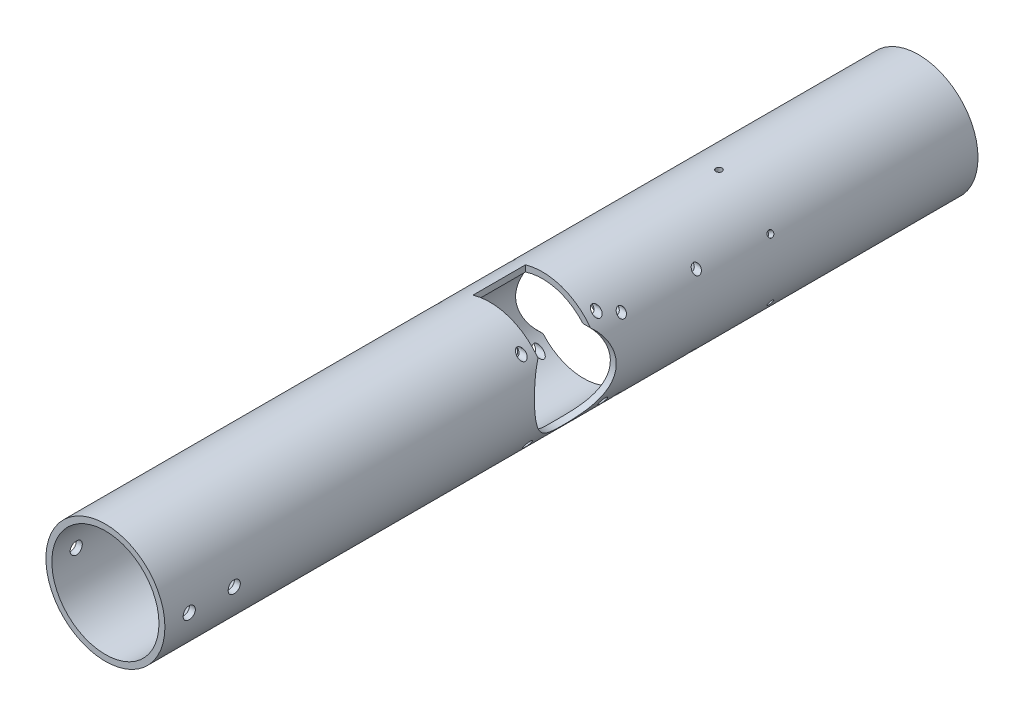
from build123d import *

# Parameters (mm, degrees)
BOSS_EXTRUDE1_DEPTH           = 125
BOSS_EXTRUDE1_DEPTH_BACK      = 250
SKETCH1_R                     = 31.75
SKETCH1_R_2                   = 28.575
SKETCH2_R                     = 21.75
CUT_EXTRUDE1_DEPTH            = 255.000246063
SKETCH3_R                     = 21.75
CUT_EXTRUDE2_DEPTH            = 255.000246187
CUT_EXTRUDE4_START            = 9
SKETCH5_W                     = 28
SKETCH5_H                     = 22
CUT_EXTRUDE4_DEPTH            = 264.000246187
CUT_EXTRUDE5_START            = -9
SKETCH6_W                     = 28
SKETCH6_H                     = 22
CUT_EXTRUDE5_DEPTH            = 264.000246187
CUT_EXTRUDE8_DEPTH            = 255.000246187
CUT_EXTRUDE8_DEPTH_BACK       = 255.000246187
SKETCH11_R                    = 2
CUT_EXTRUDE10_DEPTH           = 255.000246187
CUT_EXTRUDE10_DEPTH_BACK      = 255.000246187
SKETCH12_R                    = 3.25
CUT_EXTRUDE12_DEPTH           = 255.000246187
CUT_EXTRUDE12_DEPTH_BACK      = 255.000246187
SKETCH15_R                    = 2
SKETCH19_W                    = 2.25
SKETCH19_H                    = 31.75
M4_CLEARANCE_HOLE1_AT_2_COUNT = 2
M4_CLEARANCE_HOLE1_AT_2_PITCH = 40
M4_CLEARANCE_HOLE1_AT_3_COUNT = 2
M4_CLEARANCE_HOLE1_AT_3_PITCH = 40
M4_CLEARANCE_HOLE1_AT_4_COUNT = 2
M4_CLEARANCE_HOLE1_AT_4_PITCH = 56.568542495
M4_CLEARANCE_HOLE1_AT_5_COUNT = 2
M4_CLEARANCE_HOLE1_AT_5_PITCH = 90.126807577
M4_CLEARANCE_HOLE1_AT_6_COUNT = 2
M4_CLEARANCE_HOLE1_AT_6_PITCH = 50.197623888
M4_CLEARANCE_HOLE1_AT_7_COUNT = 2
M4_CLEARANCE_HOLE1_AT_7_PITCH = 100.213978286
M4_CLEARANCE_HOLE1_AT_8_COUNT = 2
M4_CLEARANCE_HOLE1_AT_8_PITCH = 66.631835064
MIRROR1_COPY_1_SKETCH_W       = 2.25
MIRROR1_COPY_1_SKETCH_H       = 31.75
MIRROR1_COPY_2_SKETCH_W       = 2.25
MIRROR1_COPY_2_SKETCH_H       = 31.75
MIRROR1_COPY_3_SKETCH_W       = 2.25
MIRROR1_COPY_3_SKETCH_H       = 31.75
MIRROR1_COPY_4_SKETCH_W       = 2.25
MIRROR1_COPY_4_SKETCH_H       = 31.75
MIRROR1_COPY_5_SKETCH_W       = 2.25
MIRROR1_COPY_5_SKETCH_H       = 31.75
MIRROR1_COPY_6_SKETCH_W       = 2.25
MIRROR1_COPY_6_SKETCH_H       = 31.75
MIRROR1_COPY_7_SKETCH_W       = 2.25
MIRROR1_COPY_7_SKETCH_H       = 31.75
SKETCH21_R                    = 30
CUT_EXTRUDE14_DEPTH           = 7
SKETCH23_R                    = 30
SKETCH23_R_2                  = 28.575
BOSS_EXTRUDE2_DEPTH           = 7
SKETCH24_R                    = 31.75
SKETCH24_R_2                  = 28.575
BOSS_EXTRUDE3_DEPTH           = 70.65
SKETCH25_R                    = 31.75
CUT_EXTRUDE16_DEPTH           = 1
CUT_EXTRUDE17_START           = -10
SKETCH32_R                    = 31.75
SKETCH32_R_2                  = 28.575
CUT_EXTRUDE17_DEPTH           = 10
SKETCH36_W                    = 1.65
SKETCH36_H                    = 31.75
CIRPATTERN4_COUNT             = 6


with BuildPart() as part:
    # Sketch1 → Boss-Extrude1 (new, two sides: drawn at the far end of the back side and taken through both)
    with BuildSketch(Plane.XY.offset(-BOSS_EXTRUDE1_DEPTH_BACK)):
        Circle(SKETCH1_R)
        Circle(SKETCH1_R_2, mode=Mode.SUBTRACT)
    extrude(amount=BOSS_EXTRUDE1_DEPTH + BOSS_EXTRUDE1_DEPTH_BACK)

    # Sketch2 → Cut-Extrude1 (cut, through all)
    with BuildSketch(Plane(origin=(0, 0, 0), x_dir=(0, 0, -1), z_dir=(1, 0, 0))):
        with Locations((73.488, -2)):
            Circle(SKETCH2_R)
    extrude(amount=-CUT_EXTRUDE1_DEPTH, mode=Mode.SUBTRACT)

    # Sketch3 → Cut-Extrude2 (cut, through all)
    with BuildSketch(Plane(origin=(0, 0, 0), x_dir=(0, 0, -1), z_dir=(1, 0, 0))):
        with Locations(Location((23.45, 2, 0), (0, 0, 354.723969399))):
            Circle(SKETCH3_R)
    extrude(amount=CUT_EXTRUDE2_DEPTH, mode=Mode.SUBTRACT)

    # Sketch5 → Cut-Extrude4 (cut, through all)
    with BuildSketch(Plane(origin=(0, 0, 0), x_dir=(0, 0, -1), z_dir=(1, 0, 0)).offset(CUT_EXTRUDE4_START)):
        with Locations((73.488, -23.75)):
            Rectangle(SKETCH5_W, SKETCH5_H)
    extrude(amount=-CUT_EXTRUDE4_DEPTH, mode=Mode.SUBTRACT)

    # Sketch6 → Cut-Extrude5 (cut, through all)
    with BuildSketch(Plane(origin=(0, 0, 0), x_dir=(0, 0, -1), z_dir=(1, 0, 0)).offset(CUT_EXTRUDE5_START)):
        with Locations((23.45, 23.75)):
            Rectangle(SKETCH6_W, SKETCH6_H)
    extrude(amount=CUT_EXTRUDE5_DEPTH, mode=Mode.SUBTRACT)

    # Sketch11 → Cut-Extrude8 (cut, two sides: drawn at the far end of the back side and taken through both)
    with BuildSketch(Plane(origin=(0, 0, 0), x_dir=(0, 0, -1), z_dir=(1, 0, 0)).offset(-CUT_EXTRUDE8_DEPTH_BACK)):
        with Locations((93.488, 18)):
            Circle(SKETCH11_R)
        with Locations((53.488, 18)):
            Circle(SKETCH11_R)
        with Locations((53.488, -22)):
            Circle(SKETCH11_R)
        with Locations((93.488, -22)):
            Circle(SKETCH11_R)
    extrude(amount=CUT_EXTRUDE8_DEPTH + CUT_EXTRUDE8_DEPTH_BACK, mode=Mode.SUBTRACT)

    # Sketch12 → Cut-Extrude10 (cut, two sides: drawn at the far end of the back side and taken through both)
    with BuildSketch(Plane(origin=(0, 0, 0), x_dir=(0, 0, -1), z_dir=(1, 0, 0)).offset(-CUT_EXTRUDE10_DEPTH_BACK)):
        with Locations((-112, 0)):
            Circle(SKETCH12_R)
        with Locations((-88, 0)):
            Circle(SKETCH12_R)
    extrude(amount=CUT_EXTRUDE10_DEPTH + CUT_EXTRUDE10_DEPTH_BACK, mode=Mode.SUBTRACT)

    # Sketch15 → Cut-Extrude12 (cut, two sides: drawn at the far end of the back side and taken through both)
    with BuildSketch(Plane(origin=(0, 0, 0), x_dir=(0, 0, -1), z_dir=(1, 0, 0)).offset(-CUT_EXTRUDE12_DEPTH_BACK)):
        with Locations((3.45, 22)):
            Circle(SKETCH15_R)
        with Locations((43.45, 22)):
            Circle(SKETCH15_R)
        with Locations((43.45, -18)):
            Circle(SKETCH15_R)
        with Locations((3.45, -18)):
            Circle(SKETCH15_R)
    extrude(amount=CUT_EXTRUDE12_DEPTH + CUT_EXTRUDE12_DEPTH_BACK, mode=Mode.SUBTRACT)

    # Sketch19 → M4 Clearance Hole1 (revolve, cut)
    with BuildSketch(Plane(origin=(0, 22, -3.45), x_dir=(0, 0, 1), z_dir=(0, 1, 0))):
        with Locations((1.125, 15.875)):
            Rectangle(SKETCH19_W, SKETCH19_H)
    m4_clearance_hole1 = revolve(axis=Axis((-6.35, 22, -3.45), (1, 0, 0)), mode=Mode.SUBTRACT)

    # M4 Clearance Hole1 at 2: M4 Clearance Hole1 ×2
    with Locations(*[(0, 0, -i * M4_CLEARANCE_HOLE1_AT_2_PITCH) for i in range(1, M4_CLEARANCE_HOLE1_AT_2_COUNT)]):
        add(m4_clearance_hole1, mode=Mode.SUBTRACT)

    # M4 Clearance Hole1 at 3: M4 Clearance Hole1 ×2
    with Locations(*[(0, -i * M4_CLEARANCE_HOLE1_AT_3_PITCH, 0) for i in range(1, M4_CLEARANCE_HOLE1_AT_3_COUNT)]):
        add(m4_clearance_hole1, mode=Mode.SUBTRACT)

    # M4 Clearance Hole1 at 4: M4 Clearance Hole1 ×2
    with Locations(*[Vector(0, -0.7071067811865478, -0.7071067811865472) * (i * M4_CLEARANCE_HOLE1_AT_4_PITCH) for i in range(1, M4_CLEARANCE_HOLE1_AT_4_COUNT)]):
        add(m4_clearance_hole1, mode=Mode.SUBTRACT)

    # M4 Clearance Hole1 at 5: M4 Clearance Hole1 ×2
    with Locations(*[Vector(0, -0.04438191152602306, -0.9990146374950151) * (i * M4_CLEARANCE_HOLE1_AT_5_PITCH) for i in range(1, M4_CLEARANCE_HOLE1_AT_5_COUNT)]):
        add(m4_clearance_hole1, mode=Mode.SUBTRACT)

    # M4 Clearance Hole1 at 6: M4 Clearance Hole1 ×2
    with Locations(*[Vector(0, -0.07968504662542611, -0.9968200907607669) * (i * M4_CLEARANCE_HOLE1_AT_6_PITCH) for i in range(1, M4_CLEARANCE_HOLE1_AT_6_COUNT)]):
        add(m4_clearance_hole1, mode=Mode.SUBTRACT)

    # M4 Clearance Hole1 at 7: M4 Clearance Hole1 ×2
    with Locations(*[Vector(0, -0.43906050585303297, -0.8984574960453493) * (i * M4_CLEARANCE_HOLE1_AT_7_PITCH) for i in range(1, M4_CLEARANCE_HOLE1_AT_7_COUNT)]):
        add(m4_clearance_hole1, mode=Mode.SUBTRACT)

    # M4 Clearance Hole1 at 8: M4 Clearance Hole1 ×2
    with Locations(*[Vector(0, -0.6603450131265124, -0.7509623583369185) * (i * M4_CLEARANCE_HOLE1_AT_8_PITCH) for i in range(1, M4_CLEARANCE_HOLE1_AT_8_COUNT)]):
        add(m4_clearance_hole1, mode=Mode.SUBTRACT)

    # Mirror1: M4 Clearance Hole1 across plane
    add(m4_clearance_hole1.mirror(Plane(origin=(0, 0, 0), x_dir=(0, 0, 1), z_dir=(1, 0, 0))), mode=Mode.SUBTRACT)

    # Mirror1 copy 1 sketch → Mirror1 copy 1 (revolve, cut)
    with BuildSketch(Plane(origin=(0, 22, -43.45), x_dir=(0, 0, 1), z_dir=(0, 1, 0))):
        with Locations((1.125, -15.875)):
            Rectangle(MIRROR1_COPY_1_SKETCH_W, MIRROR1_COPY_1_SKETCH_H)
    revolve(axis=Axis((6.35, 22, -43.45), (1, 0, 0)), mode=Mode.SUBTRACT)

    # Mirror1 copy 2 sketch → Mirror1 copy 2 (revolve, cut)
    with BuildSketch(Plane(origin=(0, -18, -3.45), x_dir=(0, 0, 1), z_dir=(0, 1, 0))):
        with Locations((1.125, -15.875)):
            Rectangle(MIRROR1_COPY_2_SKETCH_W, MIRROR1_COPY_2_SKETCH_H)
    revolve(axis=Axis((6.35, -18, -3.45), (1, 0, 0)), mode=Mode.SUBTRACT)

    # Mirror1 copy 3 sketch → Mirror1 copy 3 (revolve, cut)
    with BuildSketch(Plane(origin=(0, -18, -43.45), x_dir=(0, 0, 1), z_dir=(0, 1, 0))):
        with Locations((1.125, -15.875)):
            Rectangle(MIRROR1_COPY_3_SKETCH_W, MIRROR1_COPY_3_SKETCH_H)
    revolve(axis=Axis((6.35, -18, -43.45), (1, 0, 0)), mode=Mode.SUBTRACT)

    # Mirror1 copy 4 sketch → Mirror1 copy 4 (revolve, cut)
    with BuildSketch(Plane(origin=(0, 18, -93.488), x_dir=(0, 0, 1), z_dir=(0, 1, 0))):
        with Locations((1.125, -15.875)):
            Rectangle(MIRROR1_COPY_4_SKETCH_W, MIRROR1_COPY_4_SKETCH_H)
    revolve(axis=Axis((6.35, 18, -93.488), (1, 0, 0)), mode=Mode.SUBTRACT)

    # Mirror1 copy 5 sketch → Mirror1 copy 5 (revolve, cut)
    with BuildSketch(Plane(origin=(0, 18, -53.488), x_dir=(0, 0, 1), z_dir=(0, 1, 0))):
        with Locations((1.125, -15.875)):
            Rectangle(MIRROR1_COPY_5_SKETCH_W, MIRROR1_COPY_5_SKETCH_H)
    revolve(axis=Axis((6.35, 18, -53.488), (1, 0, 0)), mode=Mode.SUBTRACT)

    # Mirror1 copy 6 sketch → Mirror1 copy 6 (revolve, cut)
    with BuildSketch(Plane(origin=(0, -22, -93.488), x_dir=(0, 0, 1), z_dir=(0, 1, 0))):
        with Locations((1.125, -15.875)):
            Rectangle(MIRROR1_COPY_6_SKETCH_W, MIRROR1_COPY_6_SKETCH_H)
    revolve(axis=Axis((6.35, -22, -93.488), (1, 0, 0)), mode=Mode.SUBTRACT)

    # Mirror1 copy 7 sketch → Mirror1 copy 7 (revolve, cut)
    with BuildSketch(Plane(origin=(0, -22, -53.488), x_dir=(0, 0, 1), z_dir=(0, 1, 0))):
        with Locations((1.125, -15.875)):
            Rectangle(MIRROR1_COPY_7_SKETCH_W, MIRROR1_COPY_7_SKETCH_H)
    revolve(axis=Axis((6.35, -22, -53.488), (1, 0, 0)), mode=Mode.SUBTRACT)

    # Sketch21 → Cut-Extrude14 (cut)
    with BuildSketch(Plane(origin=(0, 0, -250), x_dir=(-1, 0, 0), z_dir=(0, 0, -1))):
        Circle(SKETCH21_R)
    extrude(amount=-CUT_EXTRUDE14_DEPTH, mode=Mode.SUBTRACT)

    # Sketch23 → Boss-Extrude2 (add)
    with BuildSketch(Plane(origin=(0, 0, -243), x_dir=(-1, 0, 0), z_dir=(0, 0, -1))):
        Circle(SKETCH23_R)
        with Locations(Location((0, 0, 0), (0, 0, 180))):
            Circle(SKETCH23_R_2, mode=Mode.SUBTRACT)
    extrude(amount=BOSS_EXTRUDE2_DEPTH)


with BuildPart() as body_2:
    # Split1: the piece on the far side of the plane
    add(part.part)
    split(bisect_by=Plane.XY.offset(75), keep=Keep.BOTTOM)


with BuildPart() as part_1:
    add(part.part)

    # Split1
    split(bisect_by=Plane.XY.offset(75), keep=Keep.TOP)


with BuildPart() as part_2:
    # Body-Move/Copy1: moved
    add(part_1.part.moved(Location((0, 0, 70.65))))


    add(body_2.part)  # Boss-Extrude3 merges body 2
    # Sketch24 → Boss-Extrude3 (add)
    with BuildSketch(Plane.XY.offset(75)):
        Circle(SKETCH24_R)
        Circle(SKETCH24_R_2, mode=Mode.SUBTRACT)
    extrude(amount=BOSS_EXTRUDE3_DEPTH)

    # Sketch25 → Cut-Extrude16 (cut)
    with BuildSketch(Plane(origin=(0, 0, -250), x_dir=(-1, 0, 0), z_dir=(0, 0, -1))):
        with Locations(Location((0, 0, 0), (0, 0, 180))):
            Circle(SKETCH25_R)
    extrude(amount=-CUT_EXTRUDE16_DEPTH, mode=Mode.SUBTRACT)

    # Sketch32 → Cut-Extrude17 (cut)
    with BuildSketch(Plane(origin=(0, 0, -249), x_dir=(-1, 0, 0), z_dir=(0, 0, -1)).offset(CUT_EXTRUDE17_START)):
        with Locations(Location((0, 0, 0), (0, 0, 180))):
            Circle(SKETCH32_R)
        with Locations(Location((0, 0, 0), (0, 0, 180))):
            Circle(SKETCH32_R_2, mode=Mode.SUBTRACT)
    extrude(amount=CUT_EXTRUDE17_DEPTH, mode=Mode.SUBTRACT)

    # Sketch34 → Cut-Revolve1 (revolve, cut)
    with BuildSketch(Plane(origin=(0, 0, 0), x_dir=(0, 0, -1), z_dir=(1, 0, 0)), mode=Mode.PRIVATE) as cut_revolve1_sk:
        Polygon((238.133974596, 31.75), (239, 30.25), (239, 31.75), align=None)
    revolve(cut_revolve1_sk.sketch.rotate(Axis((0, 0, -250), (0, 0, 1)), 270), axis=Axis((0, 0, -250), (0, 0, 1)), mode=Mode.SUBTRACT)

    # Sketch36 → M4x0.7 Tapped Hole2 (revolve, cut)
    with BuildSketch(Plane(origin=(0, 0, -131.65), x_dir=(0, 0, -1), z_dir=(1, 0, 0))):
        with Locations((0.825, 15.875)):
            Rectangle(SKETCH36_W, SKETCH36_H)
    m4x0_7_tapped_hole2 = revolve(axis=Axis((0, -6.35, -131.65), (0, 1, 0)), mode=Mode.SUBTRACT)

    # CirPattern4: M4x0.7 Tapped Hole2 ×6 about axis
    cirpattern4_axis = Axis((0, 0, -250), (0, 0, 1))
    for i in range(1, CIRPATTERN4_COUNT):
        add(m4x0_7_tapped_hole2.rotate(cirpattern4_axis, i * 360 / CIRPATTERN4_COUNT), mode=Mode.SUBTRACT)


solid = part_2.part
